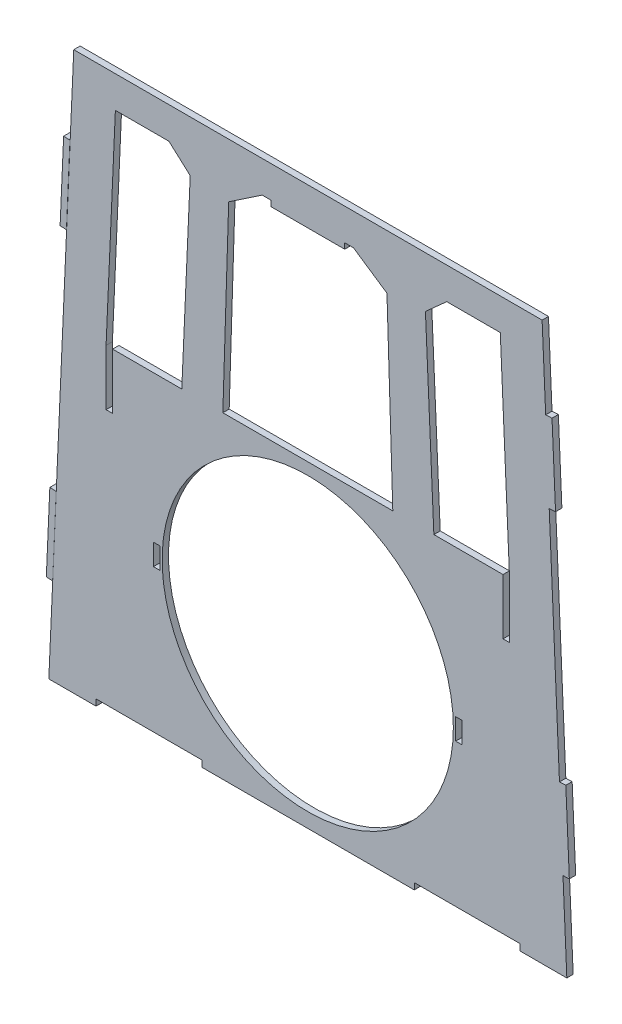
from build123d import *

# Parameters (mm, degrees)
BOSS_EXTRUDE1_DEPTH = 1.524
BOSS_EXTRUDE2_DEPTH = 1.524
SKETCH5_R           = 34.925
CUT_EXTRUDE2_DEPTH  = 2.54
SKETCH6_W           = 25.4
SKETCH6_H           = 1.524
CUT_EXTRUDE3_DEPTH  = 1.524
SKETCH7_W           = 1.524
SKETCH7_H           = 5.08
CUT_EXTRUDE4_DEPTH  = 1.524
SKETCH8_W           = 1.566256953
SKETCH8_H           = 13.370966819
SKETCH8_W_2         = 1.566256954
CUT_EXTRUDE5_DEPTH  = 1.524


with BuildPart() as part:
    # Sketch1 → Boss-Extrude1 (new body)
    with BuildSketch(Plane.XY):
        Polygon((-56.120792622, 120.430311126), (-62.105258265, -13.26978038), (62.142082471, -13.26978038), (56.212958794, 120.430311126), align=None)
        Polygon((-30.213145834, 62.891086136), (-48.37052951, 62.891086136), (-46.142817469, 112.81804423), (-33.300712762, 112.81804423), (-28.190079256, 108.231578263), align=None, mode=Mode.SUBTRACT)
        Polygon((20.401432082, 62.891086136), (-20.364607876, 62.891086136), (-18.963026929, 107.407679704), (-10.935790598, 112.81804423), (-8.828329758, 112.81804423), (-8.828329758, 111.468807562), (8.865153964, 111.468807562), (8.865153964, 112.81804423), (10.972614804, 112.81804423), (18.999851135, 107.407679704), align=None, mode=Mode.SUBTRACT)
        Polygon((48.407353716, 62.891086136), (30.24997004, 62.891086136), (28.226903463, 108.231578263), (33.337536968, 112.81804423), (46.179641675, 112.81804423), align=None, mode=Mode.SUBTRACT)
    extrude(amount=BOSS_EXTRUDE1_DEPTH)

    # Sketch2 → Boss-Extrude2 (add)
    with BuildSketch(Plane.XY.offset(1.524)):
        Polygon((-62.70469272, 7.612691153), (-61.860722425, 26.643986803), (-60.338218773, 26.57646918), (-61.182189068, 7.545173529), align=None)
        Polygon((57.910805773, 82.144333492), (59.433309425, 82.211851115), (58.589339131, 101.243146766), (57.066835478, 101.175629142), align=None)
        Polygon((61.219013274, 7.545173529), (62.741516926, 7.612691153), (61.897546632, 26.643986803), (60.375042979, 26.57646918), align=None)
        Polygon((-59.396485219, 82.211851115), (-58.552514924, 101.243146766), (-57.030011272, 101.175629142), (-57.873981567, 82.144333492), align=None)
    extrude(amount=-BOSS_EXTRUDE2_DEPTH)


with BuildPart() as boss_extrude2_piece_1:
    # of the separate pieces the step leaves, piece 1, a body of its own (boss_extrude2_pieces)
    add(part.part.solids().sort_by_distance((-56.120792622, 120.430311126, 0))[0])

    # Sketch5 → Cut-Extrude2 (cut)
    with BuildSketch(Plane.XY.offset(1.524)):
        with Locations((0, 25.14119341)):
            Circle(SKETCH5_R)
    extrude(amount=-CUT_EXTRUDE2_DEPTH, mode=Mode.SUBTRACT)

    # Sketch6 → Cut-Extrude3 (cut)
    with BuildSketch(Plane.XY.offset(1.524)):
        with Locations((38.24729306, -12.50778038)):
            Rectangle(SKETCH6_W, SKETCH6_H)
        with Locations((-38.091018839, -12.50778038)):
            Rectangle(SKETCH6_W, SKETCH6_H)
    extrude(amount=-CUT_EXTRUDE3_DEPTH, mode=Mode.SUBTRACT)

    # Sketch7 → Cut-Extrude4 (cut)
    with BuildSketch(Plane.XY.offset(1.524)):
        with Locations((-36.247543911, 25.14119341)):
            Rectangle(SKETCH7_W, SKETCH7_H)
        with Locations((36.247543911, 25.14119341)):
            Rectangle(SKETCH7_W, SKETCH7_H)
    extrude(amount=-CUT_EXTRUDE4_DEPTH, mode=Mode.SUBTRACT)

    # Sketch8 → Cut-Extrude5 (cut)
    with BuildSketch(Plane.XY.offset(1.524)):
        with Locations((47.62422524, 56.205602727)):
            Rectangle(SKETCH8_W, SKETCH8_H)
        with Locations((-47.587401033, 56.205602727)):
            Rectangle(SKETCH8_W_2, SKETCH8_H)
    extrude(amount=-CUT_EXTRUDE5_DEPTH, mode=Mode.SUBTRACT)


with BuildPart() as boss_extrude2_piece_2:
    # of the separate pieces the step leaves, piece 2, a body of its own (boss_extrude2_pieces)
    add(part.part.solids().sort_by_distance((-59.396485219, 82.211851115, 1.524))[0])


with BuildPart() as boss_extrude2_piece_3:
    # of the separate pieces the step leaves, piece 3, a body of its own (boss_extrude2_pieces)
    add(part.part.solids().sort_by_distance((-62.70469272, 7.612691153, 1.524))[0])


solid = Compound([boss_extrude2_piece_1.part, boss_extrude2_piece_2.part, boss_extrude2_piece_3.part])
